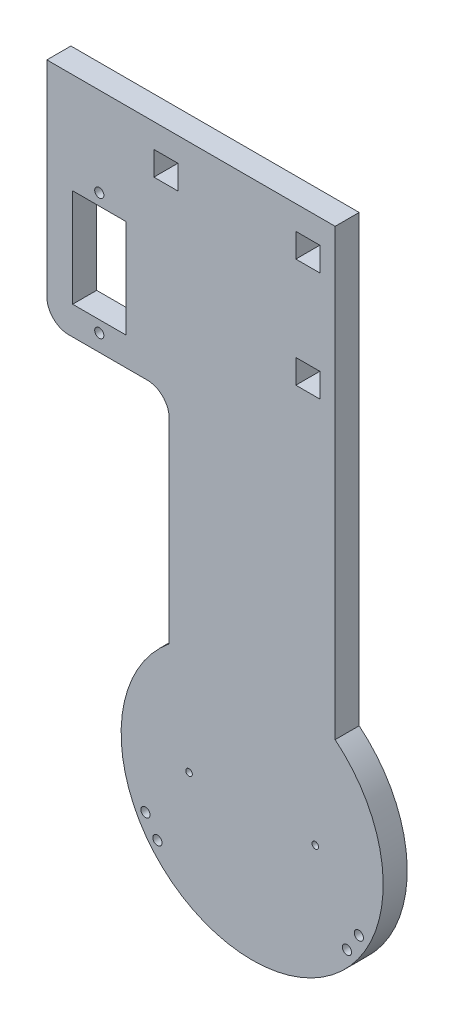
from build123d import *

# Parameters (mm, degrees)
EXTRUDE_1_DEPTH     = 5.5
SKETCH_2_W          = 12.2
SKETCH_2_H          = 22.5
CUT_EXTRUDE_1_DEPTH = 134.657210804
SKETCH_4_R          = 1.05
SKETCH_4_W          = 5.5
SKETCH_4_H          = 5.5
CUT_EXTRUDE_2_DEPTH = 134.657210804
FILLET_1_R          = 5
FILLET_2_R          = 5
SKETCH_5_R          = 0.75
CUT_EXTRUDE_3_DEPTH = 134.657210804
SKETCH_6_R          = 1.05
CUT_EXTRUDE_4_DEPTH = 134.657210804


with BuildPart() as part:
    # ｽｹｯﾁ1 → ﾎﾞｽ - 押し出し1 (new body)
    with BuildSketch(Plane.XY):
        with BuildLine():
            Line((19, 125), (-47, 125))
            Line((-47, 125), (-47, 73))
            Line((-47, 73), (-19, 73))
            Line((-19, 73), (-19, 23.216373532))
            ThreePointArc((-19, 23.216373532), (0, -30), (19, 23.216373532))
            Line((19, 23.216373532), (19, 125))
        make_face()
    extrude(amount=EXTRUDE_1_DEPTH)

    # ｽｹｯﾁ2 → ｶｯﾄ - 押し出し1 (cut, through all)
    with BuildSketch(Plane.XY.offset(5.5)):
        with Locations((-35, 90.75)):
            Rectangle(SKETCH_2_W, SKETCH_2_H)
    extrude(amount=-CUT_EXTRUDE_1_DEPTH, mode=Mode.SUBTRACT)

    # ｽｹｯﾁ4 → ｶｯﾄ - 押し出し2 (cut, through all)
    with BuildSketch(Plane.XY.offset(5.5)):
        with Locations((-35, 104.65)):
            Circle(SKETCH_4_R)
        with Locations((-35, 76.85)):
            Circle(SKETCH_4_R)
        with Locations((12.75, 116.75)):
            Rectangle(SKETCH_4_W, SKETCH_4_H)
        with Locations((-19.75, 116.75)):
            Rectangle(SKETCH_4_W, SKETCH_4_H)
        with Locations((12.75, 91.75)):
            Rectangle(SKETCH_4_W, SKETCH_4_H)
    extrude(amount=-CUT_EXTRUDE_2_DEPTH, mode=Mode.SUBTRACT)

    # ﾌｨﾚｯﾄ1
    fillet_1_edges = [part.edges().sort_by_distance(p)[0] for p in [
        (-47, 73, 2.75),
    ]]
    fillet(fillet_1_edges, radius=FILLET_1_R)

    # ﾌｨﾚｯﾄ2
    fillet_2_edges = [part.edges().sort_by_distance(p)[0] for p in [
        (-19, 73, 2.75),
    ]]
    fillet(fillet_2_edges, radius=FILLET_2_R)

    # ｽｹｯﾁ5 → ｶｯﾄ - 押し出し3 (cut, through all)
    with BuildSketch(Plane.XY.offset(5.5)):
        with Locations((14.45, 0)):
            Circle(SKETCH_5_R)
        with Locations((-14.45, 0)):
            Circle(SKETCH_5_R)
    extrude(amount=-CUT_EXTRUDE_3_DEPTH, mode=Mode.SUBTRACT)

    # ｽｹｯﾁ6 → ｶｯﾄ - 押し出し4 (cut, through all)
    with BuildSketch(Plane.XY.offset(5.5)):
        with Locations((-24.425038206, -12.880897043)):
            Circle(SKETCH_6_R)
        with Locations((-21.701843031, -17.074249883)):
            Circle(SKETCH_6_R)
        with Locations((24.425038206, -12.880897043)):
            Circle(SKETCH_6_R)
        with Locations((21.701843031, -17.074249883)):
            Circle(SKETCH_6_R)
    extrude(amount=-CUT_EXTRUDE_4_DEPTH, mode=Mode.SUBTRACT)


solid = part.part
